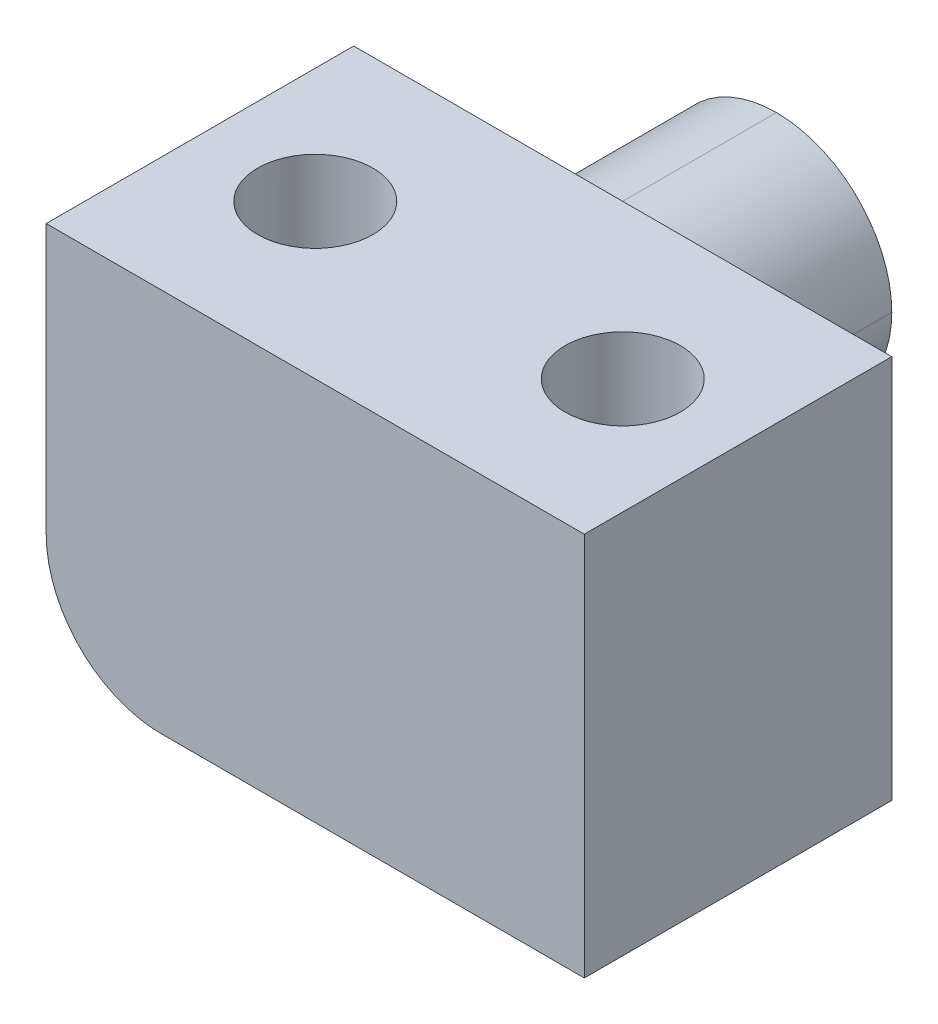
from build123d import *

# Parameters (mm, degrees)
SKETCH1_W           = 3
SKETCH1_H           = 8
BOSS_EXTRUDE1_DEPTH = 3
SKETCH2_W           = 4
SKETCH2_H           = 3
BOSS_EXTRUDE2_DEPTH = 4
SKETCH4_W           = 7
SKETCH4_H           = 4
BOSS_EXTRUDE3_DEPTH = 2
CUT_EXTRUDE2_REACH  = 10.441
SKETCH5_R           = 0.75
FILLET4_R           = 1.5


with BuildPart() as part:
    # Sketch1 → Boss-Extrude1 (new body)
    with BuildSketch(Plane(origin=(0, 0, 0), x_dir=(1, 0, 0), z_dir=(0, 1, 0))):
        Rectangle(SKETCH1_W, SKETCH1_H)
    extrude(amount=BOSS_EXTRUDE1_DEPTH)

    # Sketch2 → Boss-Extrude2 (add)
    with BuildSketch(Plane(origin=(1.5, 0, 0), x_dir=(0, 0, -1), z_dir=(1, 0, 0))):
        with Locations((-2, 1.5)):
            Rectangle(SKETCH2_W, SKETCH2_H)
    extrude(amount=BOSS_EXTRUDE2_DEPTH)

    # Sketch4 → Boss-Extrude3 (add)
    with BuildSketch(Plane(origin=(0, 3, 0), x_dir=(-1, 0, 0), z_dir=(0, -1, 0))):
        with Locations((-2, -2)):
            Rectangle(SKETCH4_W, SKETCH4_H)
    extrude(amount=-BOSS_EXTRUDE3_DEPTH)

    # Sketch5 → Cut-Extrude2 (cut, up to next)
    with BuildSketch(Plane(origin=(0, 5, 0), x_dir=(1, 0, 0), z_dir=(0, 1, 0)), mode=Mode.PRIVATE) as cut_extrude2_sk1:
        with Locations(Location((0, -2, 0), (0, 0, 270))):
            Circle(SKETCH5_R)
    cut_extrude2_tool1 = extrude(cut_extrude2_sk1.sketch, amount=-CUT_EXTRUDE2_REACH, mode=Mode.PRIVATE) & part.part
    # Sketch5 → Cut-Extrude2 (cut, up to next)
    with BuildSketch(Plane(origin=(0, 5, 0), x_dir=(1, 0, 0), z_dir=(0, 1, 0)), mode=Mode.PRIVATE) as cut_extrude2_sk2:
        with Locations(Location((4, -2, 0), (0, 0, 270))):
            Circle(SKETCH5_R)
    cut_extrude2_tool2 = extrude(cut_extrude2_sk2.sketch, amount=-CUT_EXTRUDE2_REACH, mode=Mode.PRIVATE) & part.part
    add(cut_extrude2_tool1.solids().sort_by_distance((0, 5, 2))[0], mode=Mode.SUBTRACT)
    add(cut_extrude2_tool2.solids().sort_by_distance((4, 5, 2))[0], mode=Mode.SUBTRACT)

    # Fillet4
    # the kernel refuses this fillet: 1.5 mm, written as the material it takes off along each edge
    with BuildSketch(Plane(origin=(1.5, 0, -7.75), x_dir=(-1, 0, 0), z_dir=(0, 0, 1)), Plane(origin=(1.5, 3, -7.75), x_dir=(0, -1, 0), z_dir=(0, 0, 1)), Plane(origin=(-1.5, 3, 0), x_dir=(0, -1, 0), z_dir=(0, 0, -1))) as fillet4_piece_1:
        with BuildLine():
            CenterArc((FILLET4_R, -FILLET4_R), FILLET4_R, 90, 90)
            Line((0, -FILLET4_R), (0, 0))
            Line((0, 0), (FILLET4_R, 0))
        make_face()
    extrude(amount=7.75, mode=Mode.SUBTRACT)
    with BuildSketch(Plane(origin=(-1.5, 0, 7.75), x_dir=(1, 0, 0), z_dir=(0, 0, -1))) as fillet4_piece_2:
        with BuildLine():
            CenterArc((FILLET4_R, -FILLET4_R), FILLET4_R, 90, 90)
            Line((0, -FILLET4_R), (0, 0))
            Line((0, 0), (FILLET4_R, 0))
        make_face()
    extrude(amount=15.5, mode=Mode.SUBTRACT)


solid = part.part
